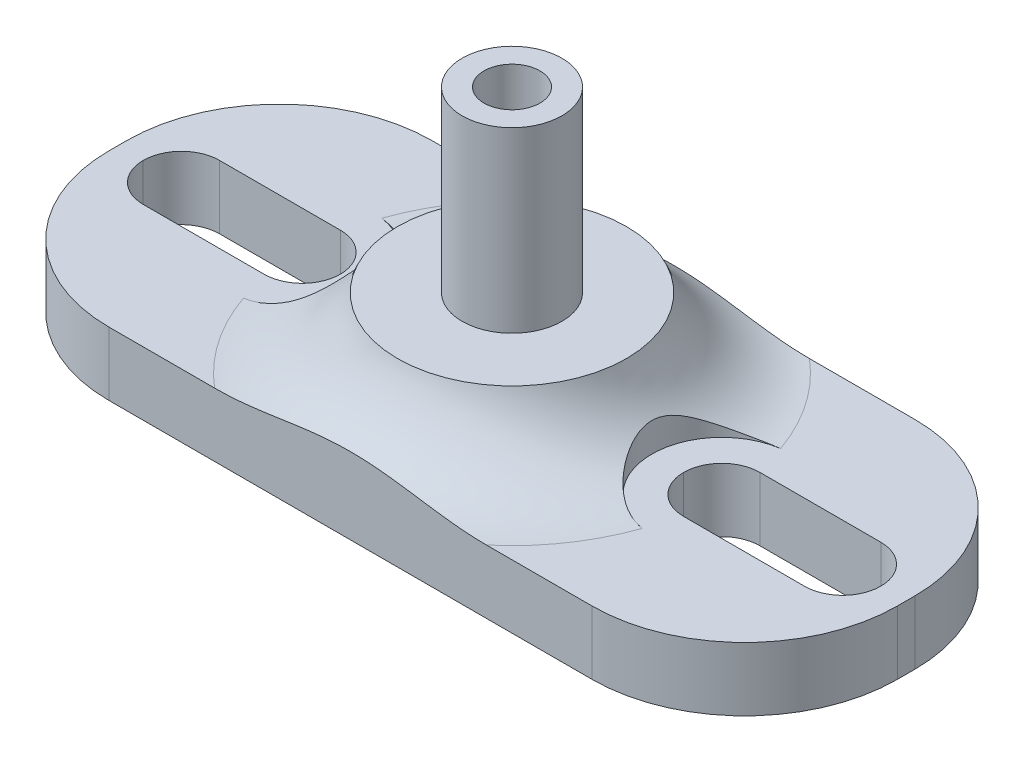
from build123d import *

# Parameters (mm, degrees)
SKETCH1_W           = 62
SKETCH1_H           = 25.4
SKETCH1_R           = 3.925
SKETCH1_W_2         = 15.5
SKETCH1_H_2         = 6
BOSS_EXTRUDE1_DEPTH = 5
SKETCH1_3_R         = 3.925
SKETCH1_3_R_2       = 2.2
BOSS_EXTRUDE2_DEPTH = 24.5
FILLET1_R           = 3
SKETCH2_R           = 9
BOSS_EXTRUDE3_DEPTH = 5.5
FILLET2_R           = 8
SKETCH3_R           = 5.5
CUT_EXTRUDE1_DEPTH  = 5.5
FILLET3_R           = 12
SKETCH4_R           = 2.2
CUT_EXTRUDE2_DEPTH  = 42.503493918


# Some blends are built 0.0001 mm under size
with BuildPart() as part:
    # Sketch1 → Boss-Extrude1 (new body)
    with BuildSketch(Plane(origin=(0, 0, 0), x_dir=(1, 0, 0), z_dir=(0, 1, 0))):
        Rectangle(SKETCH1_W, SKETCH1_H)
        with Locations(Location((0, 0, 0), (0, 0, 270))):
            Circle(SKETCH1_R, mode=Mode.SUBTRACT)
        with Locations((-21.25, 0)):
            Rectangle(SKETCH1_W_2, SKETCH1_H_2, mode=Mode.SUBTRACT)
        with Locations((21.25, 0)):
            Rectangle(SKETCH1_W_2, SKETCH1_H_2, mode=Mode.SUBTRACT)
    extrude(amount=BOSS_EXTRUDE1_DEPTH)

    # Sketch1<3> → Boss-Extrude2 (add)
    with BuildSketch(Plane(origin=(0, 0, 0), x_dir=(1, 0, 0), z_dir=(0, 1, 0))):
        with Locations(Location((0, 0, 0), (0, 0, 270))):
            Circle(SKETCH1_3_R)
        with Locations(Location((0, 0, 0), (0, 0, 270))):
            Circle(SKETCH1_3_R_2, mode=Mode.SUBTRACT)
    extrude(amount=BOSS_EXTRUDE2_DEPTH)

    # Fillet1
    fillet1_edges = [part.edges().sort_by_distance(p)[0] for p in [
        (29, 2.5, 3),
        (13.5, 2.5, 3),
        (29, 2.5, -3),
        (13.5, 2.5, -3),
        (-29, 2.5, 3),
        (-29, 2.5, -3),
        (-13.5, 2.5, 3),
        (-13.5, 2.5, -3),
    ]]
    fillet(fillet1_edges, radius=FILLET1_R - 0.0001)  # a hair under: the kernel refuses the full size

    # Sketch2 → Boss-Extrude3 (add)
    with BuildSketch(Plane(origin=(0, 5, 0), x_dir=(1, 0, 0), z_dir=(0, 1, 0))):
        with Locations(Location((0, 0, 0), (0, 0, 270))):
            Circle(SKETCH2_R)
    extrude(amount=BOSS_EXTRUDE3_DEPTH)

    # Fillet2
    # the kernel refuses this fillet: 8 mm, written as the material it adds along each edge
    with BuildSketch(Plane(origin=(0, 5, 0), x_dir=(0, 0, 1), z_dir=(-1, 0, 0))) as fillet2_piece_1_section:
        with BuildLine():
            CenterArc((16.599342077, 8), FILLET2_R, 198.209956864, 71.790043136)
            Line((9, 5.5), (9, 0))
            Line((9, 0), (16.599342077, 0))
        make_face()
    fillet2_piece_1 = revolve(axis=Axis((0, 5, 0), (0, 1, 0)), mode=Mode.PRIVATE)
    fillet2_piece_1 = fillet2_piece_1 - Plane(origin=(-16.4999, 5, -0.0001), x_dir=(0, 0, -1), z_dir=(0, 1, 0)) * Cylinder(2.9999, 67, mode=Mode.PRIVATE)
    fillet2_piece_1 = split(fillet2_piece_1, bisect_by=Plane(origin=(0, 5, 12.7), z_dir=(0, 0, -1)), keep=Keep.TOP, mode=Mode.PRIVATE)
    fillet2_piece_1 = split(fillet2_piece_1, bisect_by=Plane(origin=(0, 5, -12.7), z_dir=(0, 0, 1)), keep=Keep.TOP, mode=Mode.PRIVATE)
    fillet2_piece_1 = fillet2_piece_1 - Plane(origin=(16.4999, 5, 0.0001), x_dir=(0, 0, 1), z_dir=(0, 1, 0)) * Cylinder(2.9999, 67, mode=Mode.PRIVATE)
    add(fillet2_piece_1)

    # Sketch3 → Cut-Extrude1 (cut)
    with BuildSketch(Plane(origin=(0, 5, 0), x_dir=(1, 0, 0), z_dir=(0, 1, 0))):
        with Locations((16.5, 0)):
            Circle(SKETCH3_R)
        with Locations((-16.5, 0)):
            Circle(SKETCH3_R)
    extrude(amount=CUT_EXTRUDE1_DEPTH, mode=Mode.SUBTRACT)

    # Fillet3
    fillet3_edges = [part.edges().sort_by_distance(p)[0] for p in [
        (-31, 2.5, 12.7),
        (-31, 2.5, -12.7),
        (31, 2.5, -12.7),
        (31, 2.5, 12.7),
    ]]
    fillet(fillet3_edges, radius=FILLET3_R)

    # Sketch4 → Cut-Extrude2 (cut, through all)
    with BuildSketch(Plane(origin=(0, 24.5, 0), x_dir=(1, 0, 0), z_dir=(0, 1, 0))):
        with Locations(Location((0, 0, 0), (0, 0, 270))):
            Circle(SKETCH4_R)
    extrude(amount=-CUT_EXTRUDE2_DEPTH, mode=Mode.SUBTRACT)


solid = part.part
